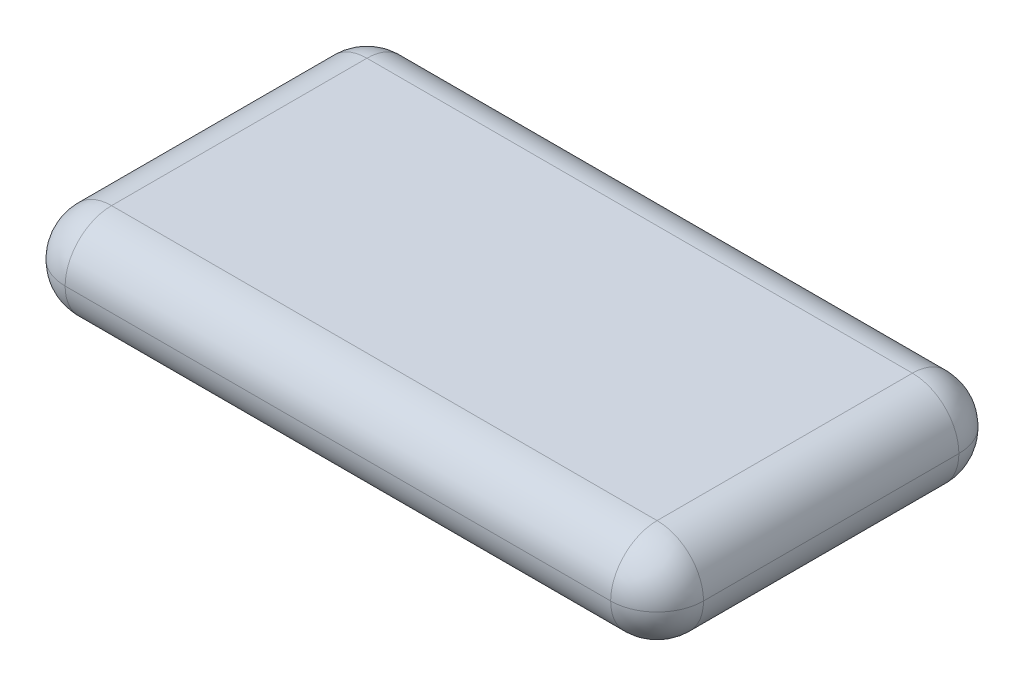
from build123d import *

# Parameters (mm, degrees)
SKETCH1_W           = 550
SKETCH1_H           = 300
BOSS_EXTRUDE1_DEPTH = 80
FILLET1_R           = 40
FILLET2_R           = 40


# Some blends are built 0.0001 mm under size
with BuildPart() as part:
    # Sketch1 → Boss-Extrude1 (new body)
    with BuildSketch(Plane(origin=(0, 0, 0), x_dir=(1, 0, 0), z_dir=(0, 1, 0))):
        Rectangle(SKETCH1_W, SKETCH1_H)
    extrude(amount=BOSS_EXTRUDE1_DEPTH)

    # Fillet1
    fillet1_edges = [part.edges().sort_by_distance(p)[0] for p in [
        (-275, 80, 0),
        (0, 80, 150),
        (275, 80, 0),
        (0, 0, 150),
        (-275, 0, 0),
        (0, 0, -150),
        (275, 0, 0),
        (-275, 40, -150),
        (275, 40, -150),
        (0, 80, -150),
    ]]
    fillet(fillet1_edges, radius=FILLET1_R - 0.0001)  # a hair under: the kernel refuses the full size

    # Fillet2
    # the kernel refuses this fillet: 40 mm, written as the material it takes off along each edge
    with BuildSketch(Plane(origin=(235, 0, 110), x_dir=(1, 0, 0), z_dir=(0, 0, -1))) as fillet2_piece_1:
        with BuildLine():
            CenterArc((0.0001, -39.9999), 39.9999, 0, 90)
            Line((40, -39.9999), (40, 0))
            Line((40, 0), (0.0001, 0))
        make_face()
    revolve(axis=Axis((235, 0, 110), (0, -1, 0)), revolution_arc=90, mode=Mode.SUBTRACT)
    with BuildSketch(Plane(origin=(-235, 0, 110), x_dir=(0, 0, 1), z_dir=(1, 0, 0))) as fillet2_piece_2:
        with BuildLine():
            CenterArc((0.0001, -39.9999), 39.9999, 0, 90)
            Line((40, -39.9999), (40, 0))
            Line((40, 0), (0.0001, 0))
        make_face()
    revolve(axis=Axis((-235, 0, 110), (0, -1, 0)), revolution_arc=90, mode=Mode.SUBTRACT)
    with BuildSketch(Plane(origin=(-235, 80, 110), x_dir=(-1, 0, 0), z_dir=(0, 0, -1))) as fillet2_piece_3:
        with BuildLine():
            CenterArc((0.0001, -39.9999), 39.9999, 0, 90)
            Line((40, -39.9999), (40, 0))
            Line((40, 0), (0.0001, 0))
        make_face()
    revolve(axis=Axis((-235, 80, 110), (0, 1, 0)), revolution_arc=90, mode=Mode.SUBTRACT)
    with BuildSketch(Plane(origin=(235, 80, 110), x_dir=(0, 0, 1), z_dir=(-1, 0, 0))) as fillet2_piece_4:
        with BuildLine():
            CenterArc((0.0001, -39.9999), 39.9999, 0, 90)
            Line((40, -39.9999), (40, 0))
            Line((40, 0), (0.0001, 0))
        make_face()
    revolve(axis=Axis((235, 80, 110), (0, 1, 0)), revolution_arc=90, mode=Mode.SUBTRACT)
    with BuildSketch(Plane(origin=(275, 0, 150), x_dir=(0, 0, -1), z_dir=(0, 1, 0))) as fillet2_piece_5:
        with BuildLine():
            CenterArc((FILLET2_R, FILLET2_R), FILLET2_R, 180, 90)
            Line((0, FILLET2_R), (0, 0))
            Line((0, 0), (FILLET2_R, 0))
        make_face()
    extrude(amount=80, mode=Mode.SUBTRACT)
    with BuildSketch(Plane(origin=(-275, 0, 150), x_dir=(0, 0, -1), z_dir=(0, 1, 0))) as fillet2_piece_6:
        with BuildLine():
            CenterArc((FILLET2_R, -FILLET2_R), FILLET2_R, 90, 90)
            Line((0, -FILLET2_R), (0, 0))
            Line((0, 0), (FILLET2_R, 0))
        make_face()
    extrude(amount=80, mode=Mode.SUBTRACT)


solid = part.part
